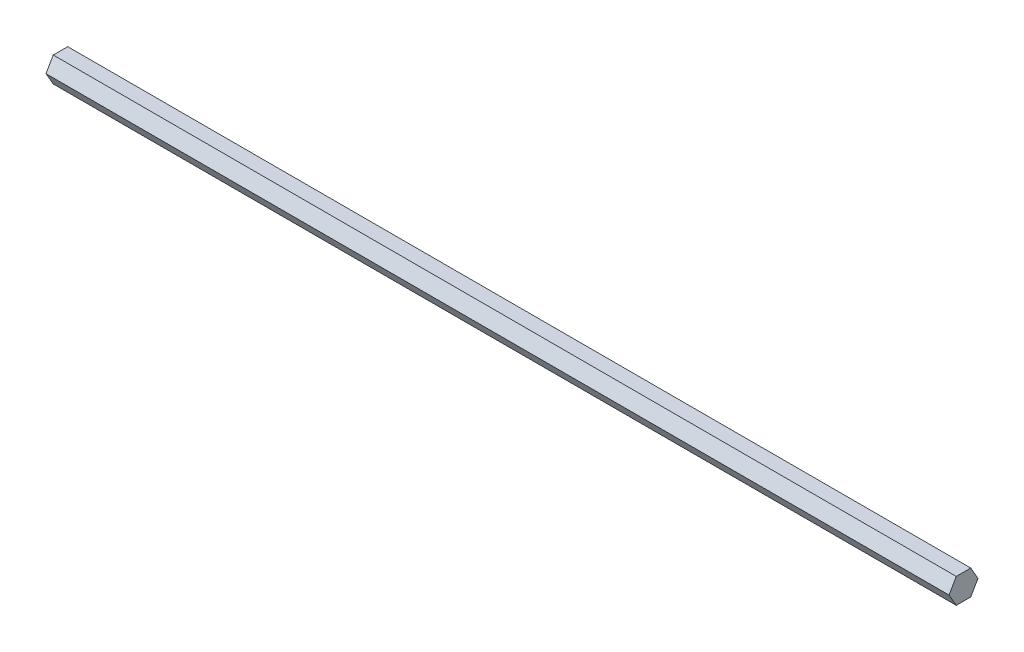
from build123d import *

# Parameters (mm, degrees)
BOSS_EXTRUDE1_DEPTH = 228.6


with BuildPart() as part:
    # Sketch1 → Boss-Extrude1 (new, symmetric)
    with BuildSketch(Plane(origin=(0, 0, 0), x_dir=(0, 0, -1), z_dir=(1, 0, 0))):
        Polygon((7.332348419, 0), (3.666174209, 6.35), (-3.666174209, 6.35), (-7.332348419, 0), (-3.666174209, -6.35), (3.666174209, -6.35), align=None)
    extrude(amount=BOSS_EXTRUDE1_DEPTH, both=True)


solid = part.part
